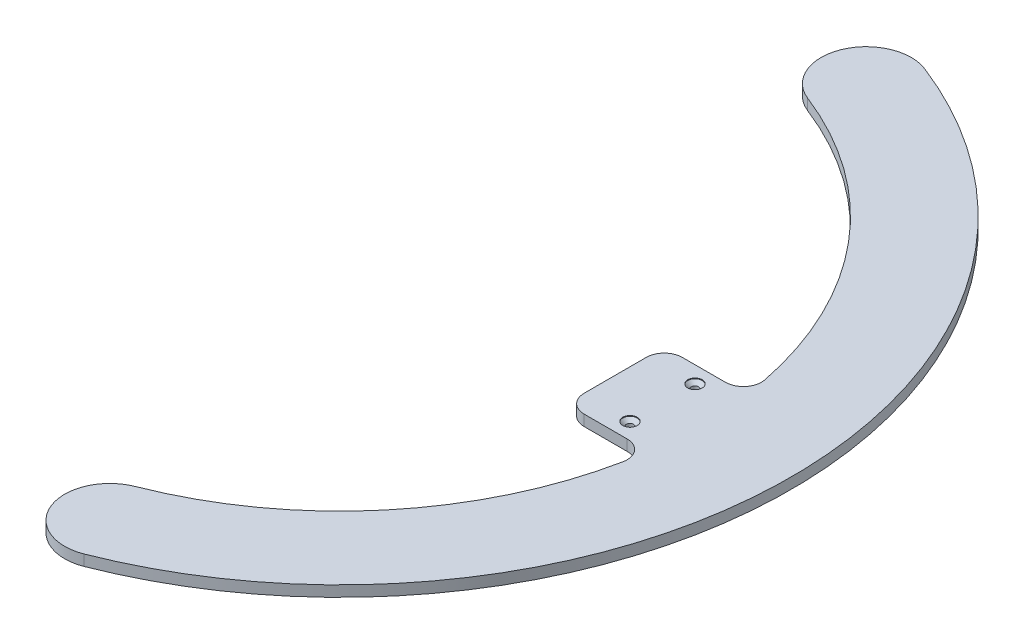
from build123d import *

# Parameters (mm, degrees)
SKETCH1_R                                      = 1
BOSS_EXTRUDE1_DEPTH                            = 3
FILLET1_R                                      = 12.5
BOSS_EXTRUDE2_START                            = -1.6
BOSS_EXTRUDE2_DEPTH                            = 1.6
CSK_FOR_M2_FLAT_HEAD_MACHINE_SCREW1_AT_2_COUNT = 2
CSK_FOR_M2_FLAT_HEAD_MACHINE_SCREW1_AT_2_PITCH = 18
FILLET2_R                                      = 5


with BuildPart() as part:
    # Sketch1 → Boss-Extrude1 (new body)
    with BuildSketch(Plane(origin=(0, 0, 0), x_dir=(1, 0, 0), z_dir=(0, 1, 0))):
        with BuildLine():
            Line((32.352380638, 120.740728286), (25.88190451, 96.592582629))
            ThreePointArc((25.88190451, 96.592582629), (75.00161341, 66.141953296), (99.070883715, 13.6))
            Line((99.070883715, 13.6), (76.236612975, 13.6))
            Line((76.236612975, 13.6), (76.236612975, -13.6))
            Line((76.236612975, -13.6), (99.070883715, -13.6))
            ThreePointArc((99.070883715, -13.6), (75.00161341, -66.141953296), (25.88190451, -96.592582629))
            Line((25.88190451, -96.592582629), (32.352380638, -120.740728286))
            ThreePointArc((32.352380638, -120.740728286), (125, 0), (32.352380638, 120.740728286))
        make_face()
        with BuildLine():
            ThreePointArc((80.650826538, 7.4), (79.236612975, 7.4), (79.236612975, 8.814213562))
            Line((79.236612975, 8.814213562), (79.236612975, 9.185786438))
            ThreePointArc((79.236612975, 9.185786438), (79.236612975, 10.6), (80.650826538, 10.6))
            Line((80.650826538, 10.6), (84.022399413, 10.6))
            ThreePointArc((84.022399413, 10.6), (85.436612975, 10.6), (85.436612975, 9.185786438))
            Line((85.436612975, 9.185786438), (85.436612975, 8.814213562))
            ThreePointArc((85.436612975, 8.814213562), (85.436612975, 7.4), (84.022399413, 7.4))
            Line((84.022399413, 7.4), (80.650826538, 7.4))
        make_face(mode=Mode.SUBTRACT)
        with Locations(Location((89.336612975, 9, 0), (0, 0, 270))):
            Circle(SKETCH1_R, mode=Mode.SUBTRACT)
        with BuildLine():
            ThreePointArc((93.236612975, 9.185786438), (93.236612975, 10.6), (94.650826538, 10.6))
            Line((94.650826538, 10.6), (98.022399413, 10.6))
            ThreePointArc((98.022399413, 10.6), (99.362589189, 10.666977143), (99.56285316, 9.340142972))
            ThreePointArc((99.56285316, 9.340142972), (99.599997793, 8.93534776), (99.635496648, 8.530404901))
            ThreePointArc((99.635496648, 8.530404901), (99.303389883, 7.288169964), (98.022399413, 7.4))
            Line((98.022399413, 7.4), (94.650826538, 7.4))
            ThreePointArc((94.650826538, 7.4), (93.236612975, 7.4), (93.236612975, 8.814213562))
            Line((93.236612975, 8.814213562), (93.236612975, 9.185786438))
        make_face(mode=Mode.SUBTRACT)
        with BuildLine():
            ThreePointArc((98.022399413, -7.4), (99.303389883, -7.288169964), (99.635496648, -8.530404901))
            ThreePointArc((99.635496648, -8.530404901), (99.599997793, -8.93534776), (99.56285316, -9.340142972))
            ThreePointArc((99.56285316, -9.340142972), (99.362589189, -10.666977143), (98.022399413, -10.6))
            Line((98.022399413, -10.6), (94.650826538, -10.6))
            ThreePointArc((94.650826538, -10.6), (93.236612975, -10.6), (93.236612975, -9.185786438))
            Line((93.236612975, -9.185786438), (93.236612975, -8.814213562))
            ThreePointArc((93.236612975, -8.814213562), (93.236612975, -7.4), (94.650826538, -7.4))
            Line((94.650826538, -7.4), (98.022399413, -7.4))
        make_face(mode=Mode.SUBTRACT)
        with Locations(Location((89.336612975, -9, 0), (0, 0, 270))):
            Circle(SKETCH1_R, mode=Mode.SUBTRACT)
        with BuildLine():
            ThreePointArc((85.436612975, -9.185786438), (85.436612975, -10.6), (84.022399413, -10.6))
            Line((84.022399413, -10.6), (80.650826538, -10.6))
            ThreePointArc((80.650826538, -10.6), (79.236612975, -10.6), (79.236612975, -9.185786438))
            Line((79.236612975, -9.185786438), (79.236612975, -8.814213562))
            ThreePointArc((79.236612975, -8.814213562), (79.236612975, -7.4), (80.650826538, -7.4))
            Line((80.650826538, -7.4), (84.022399413, -7.4))
            ThreePointArc((84.022399413, -7.4), (85.436612975, -7.4), (85.436612975, -8.814213562))
            Line((85.436612975, -8.814213562), (85.436612975, -9.185786438))
        make_face(mode=Mode.SUBTRACT)
    extrude(amount=BOSS_EXTRUDE1_DEPTH)

    # Fillet1
    fillet1_edges = [part.edges().sort_by_distance(p)[0] for p in [
        (32.352380638, 1.5, 120.740728286),
        (25.88190451, 1.5, 96.592582629),
        (32.352380638, 1.5, -120.740728286),
        (25.88190451, 1.5, -96.592582629),
    ]]
    fillet(fillet1_edges, radius=FILLET1_R - 0.0001)  # a hair under: the kernel refuses the full size

    # Sketch2 → Boss-Extrude2 (add)
    with BuildSketch(Plane(origin=(0, 3, 0), x_dir=(1, 0, 0), z_dir=(0, 1, 0)).offset(BOSS_EXTRUDE2_START)):
        with BuildLine():
            Line((80.650826538, 7.4), (84.022399413, 7.4))
            ThreePointArc((84.022399413, 7.4), (85.436612975, 7.4), (85.436612975, 8.814213562))
            Line((85.436612975, 8.814213562), (85.436612975, 9.185786438))
            ThreePointArc((85.436612975, 9.185786438), (85.436612975, 10.6), (84.022399413, 10.6))
            Line((84.022399413, 10.6), (80.650826538, 10.6))
            ThreePointArc((80.650826538, 10.6), (79.236612975, 10.6), (79.236612975, 9.185786438))
            Line((79.236612975, 9.185786438), (79.236612975, 8.814213562))
            ThreePointArc((79.236612975, 8.814213562), (79.236612975, 7.4), (80.650826538, 7.4))
        make_face()
        with BuildLine():
            Line((93.236612975, 9.185786438), (93.236612975, 8.814213562))
            ThreePointArc((93.236612975, 8.814213562), (93.236612975, 7.4), (94.650826538, 7.4))
            Line((94.650826538, 7.4), (98.022399413, 7.4))
            ThreePointArc((98.022399413, 7.4), (99.303389883, 7.288169964), (99.635496648, 8.530404901))
            ThreePointArc((99.635496648, 8.530404901), (99.599997793, 8.93534776), (99.56285316, 9.340142972))
            ThreePointArc((99.56285316, 9.340142972), (99.362589189, 10.666977143), (98.022399413, 10.6))
            Line((98.022399413, 10.6), (94.650826538, 10.6))
            ThreePointArc((94.650826538, 10.6), (93.236612975, 10.6), (93.236612975, 9.185786438))
        make_face()
        with BuildLine():
            Line((84.022399413, -7.4), (80.650826538, -7.4))
            ThreePointArc((80.650826538, -7.4), (79.236612975, -7.4), (79.236612975, -8.814213562))
            Line((79.236612975, -8.814213562), (79.236612975, -9.185786438))
            ThreePointArc((79.236612975, -9.185786438), (79.236612975, -10.6), (80.650826538, -10.6))
            Line((80.650826538, -10.6), (84.022399413, -10.6))
            ThreePointArc((84.022399413, -10.6), (85.436612975, -10.6), (85.436612975, -9.185786438))
            Line((85.436612975, -9.185786438), (85.436612975, -8.814213562))
            ThreePointArc((85.436612975, -8.814213562), (85.436612975, -7.4), (84.022399413, -7.4))
        make_face()
        with BuildLine():
            Line((93.236612975, -8.814213562), (93.236612975, -9.185786438))
            ThreePointArc((93.236612975, -9.185786438), (93.236612975, -10.6), (94.650826538, -10.6))
            Line((94.650826538, -10.6), (98.022399413, -10.6))
            ThreePointArc((98.022399413, -10.6), (99.362589189, -10.666977143), (99.56285316, -9.340142972))
            ThreePointArc((99.56285316, -9.340142972), (99.599997793, -8.93534776), (99.635496648, -8.530404901))
            ThreePointArc((99.635496648, -8.530404901), (99.303389883, -7.288169964), (98.022399413, -7.4))
            Line((98.022399413, -7.4), (94.650826538, -7.4))
            ThreePointArc((94.650826538, -7.4), (93.236612975, -7.4), (93.236612975, -8.814213562))
        make_face()
    extrude(amount=BOSS_EXTRUDE2_DEPTH)

    # Sketch4 → CSK for M2 Flat Head Machine Screw1 (revolve, cut)
    with BuildSketch(Plane(origin=(89.336612975, 3, -9), x_dir=(0, 0, 1), z_dir=(1, 0, 0))):
        Polygon((0, 0), (0, 3), (1, 3), (1, 1.2), (2, 0.2), (2, 0), align=None)
    csk_for_m2_flat_head_machine_screw1 = revolve(axis=Axis((89.336612975, 9.35, -9), (0, -1, 0)), mode=Mode.SUBTRACT)

    # CSK for M2 Flat Head Machine Screw1 at 2: CSK for M2 Flat Head Machine Screw1 ×2
    with Locations(*[(0, 0, i * CSK_FOR_M2_FLAT_HEAD_MACHINE_SCREW1_AT_2_PITCH) for i in range(1, CSK_FOR_M2_FLAT_HEAD_MACHINE_SCREW1_AT_2_COUNT)]):
        add(csk_for_m2_flat_head_machine_screw1, mode=Mode.SUBTRACT)

    # Fillet2
    fillet2_edges = [part.edges().sort_by_distance(p)[0] for p in [
        (99.070883715, 1.5, -13.6),
        (99.070883715, 1.5, 13.6),
        (76.236612975, 1.5, 13.6),
        (76.236612975, 1.5, -13.6),
    ]]
    fillet(fillet2_edges, radius=FILLET2_R)


solid = part.part
